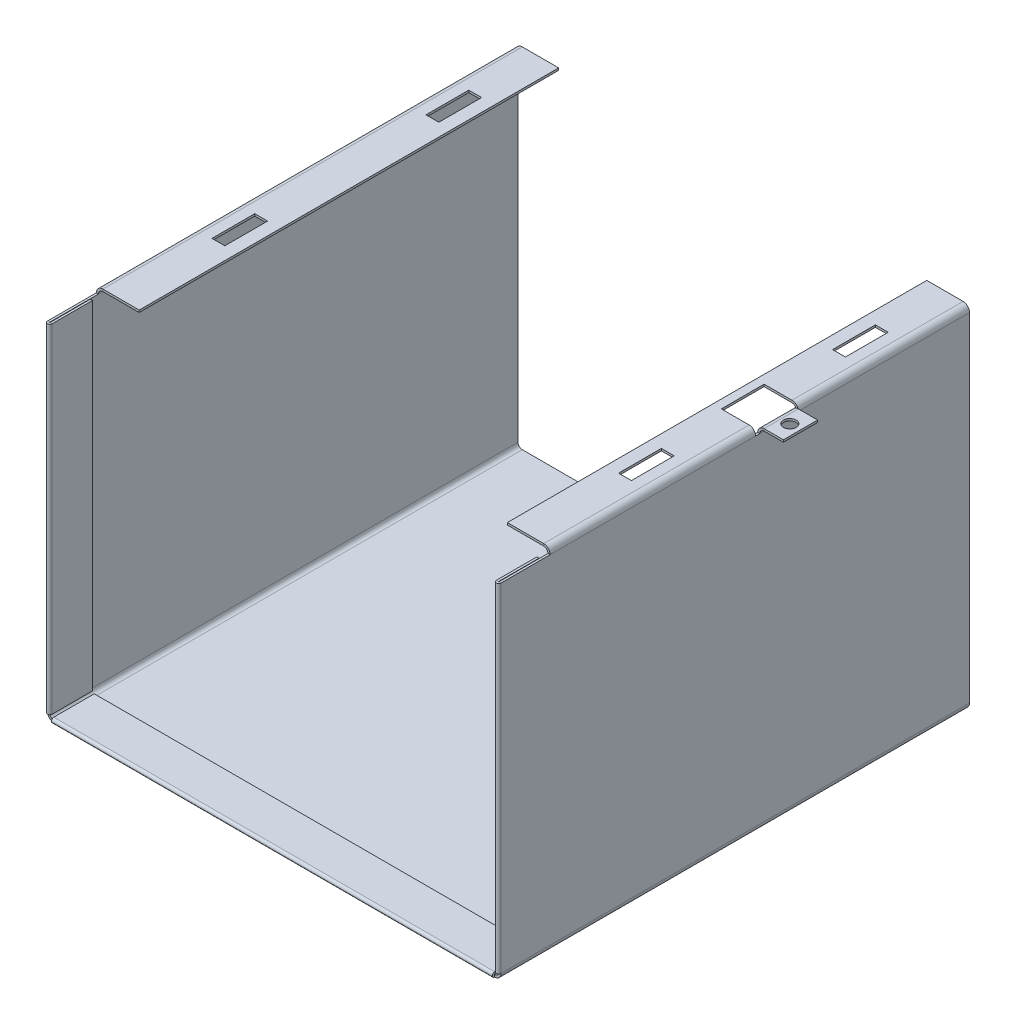
from build123d import *

# Parameters (mm, degrees)
SM_BASE_FLANGE_1_DEPTH = 55
OTHER_START            = -1
OTHER_1_DEPTH          = 2
OTHER_START_2          = 1
OTHER_1_2_DEPTH        = 79
OTHER_START_3          = -0.24719
OTHER_1_3_DEPTH        = 81.24719
OTHER_START_4          = -51.5
OTHER_1_4_DEPTH        = 103
OTHER_1_5_DEPTH        = 103
SM_EDGE_FLANGE_1_DEPTH = 98
SKETCH_19_W            = 10
SKETCH_19_H            = 10
CUT_EXTRUDE_1_DEPTH    = 1.5
SM_EDGE_FLANGE_2_DEPTH = 8
SKETCH_24_R            = 1.5
CUT_EXTRUDE_2_DEPTH    = 0.5
SKETCH_27_W            = 3
SKETCH_27_H            = 10
CUT_EXTRUDE_3_DEPTH    = 0.5


with BuildPart() as part:
    # 基体-法兰1: sheet metal written as solids
    # Sketch 1 → 基体-法兰1 (new, symmetric)
    with BuildSketch(Plane.XY):
        with BuildLine():
            Line((-52.5, 80), (-52.5, 1))
            ThreePointArc((-52.5, 1), (-52.207106781, 0.292893219), (-51.5, 0))
            Line((-51.5, 0), (51.5, 0))
            ThreePointArc((51.5, 0), (52.207106781, 0.292893219), (52.5, 1))
            Line((52.5, 1), (52.5, 80))
            Line((52.5, 80), (53, 80))
            Line((53, 80), (53, 1))
            ThreePointArc((53, 1), (52.560660172, -0.060660172), (51.5, -0.5))
            Line((51.5, -0.5), (-51.5, -0.5))
            ThreePointArc((-51.5, -0.5), (-52.560660172, -0.060660172), (-53, 1))
            Line((-53, 1), (-53, 80))
            Line((-53, 80), (-52.5, 80))
        make_face()
    extrude(amount=SM_BASE_FLANGE_1_DEPTH, both=True)

    # Other 1: read off the stored shape, not the designer's step
    # Other 1 outline → Other 1 (cut)
    with BuildSketch(Plane(origin=(0, 0, 0), x_dir=(1, 0, 0), z_dir=(0, 1, 0)).offset(OTHER_START)):
        with BuildLine():
            Line((51.5, -54.45), (51.5, -55))
            Line((51.5, -55), (52.45, -55))
            ThreePointArc((52.45, -55), (52.83890873, -54.83890873), (53, -54.45))
            Line((53, -54.45), (51.5, -54.45))
        make_face()
        with BuildLine():
            Line((-52.45, -55), (-51.5, -55))
            Line((-51.5, -55), (-51.5, -54.45))
            Line((-51.5, -54.45), (-53, -54.45))
            ThreePointArc((-53, -54.45), (-52.83890873, -54.83890873), (-52.45, -55))
        make_face()
    extrude(amount=OTHER_1_DEPTH, mode=Mode.SUBTRACT)

    # Other 1 2 outline → Other 1 2 (add)
    with BuildSketch(Plane(origin=(0, 0, 0), x_dir=(1, 0, 0), z_dir=(0, 1, 0)).offset(OTHER_START_2)):
        with BuildLine():
            Line((51.9, -45), (51.9, -54.45))
            ThreePointArc((51.9, -54.45), (52.45, -55), (53, -54.45))
            Line((53, -54.45), (52.5, -54.45))
            ThreePointArc((52.5, -54.45), (52.45, -54.5), (52.4, -54.45))
            Line((52.4, -54.45), (52.4, -45))
            Line((52.4, -45), (51.9, -45))
        make_face()
        with BuildLine():
            ThreePointArc((-53, -54.45), (-52.45, -55), (-51.9, -54.45))
            Line((-51.9, -54.45), (-51.9, -45))
            Line((-51.9, -45), (-52.4, -45))
            Line((-52.4, -45), (-52.4, -54.45))
            ThreePointArc((-52.4, -54.45), (-52.45, -54.5), (-52.5, -54.45))
            Line((-52.5, -54.45), (-53, -54.45))
        make_face()
    extrude(amount=OTHER_1_2_DEPTH)

    # Other 1 3 outline → Other 1 3 (cut)
    with BuildSketch(Plane(origin=(0, 0, 0), x_dir=(1, 0, 0), z_dir=(0, 1, 0)).offset(OTHER_START_3)):
        with BuildLine():
            ThreePointArc((-52.45, -55), (-52.83890873, -54.83890873), (-53, -54.45))
            Line((-53, -54.45), (-53, -55))
            Line((-53, -55), (-52.45, -55))
        make_face()
        with BuildLine():
            Line((52.45, -55), (53, -55))
            Line((53, -55), (53, -54.45))
            ThreePointArc((53, -54.45), (52.83890873, -54.83890873), (52.45, -55))
        make_face()
    extrude(amount=OTHER_1_3_DEPTH, mode=Mode.SUBTRACT)

    # Other 1 4 outline → Other 1 4 (cut)
    with BuildSketch(Plane.YZ.offset(OTHER_START_4)):
        with BuildLine():
            ThreePointArc((-0.5, 54.45), (-0.35620192, 54.820809924), (0, 54.997722558))
            Line((0, 54.997722558), (0, 55))
            Line((0, 55), (-0.5, 55))
            Line((-0.5, 55), (-0.5, 54.45))
        make_face()
    extrude(amount=OTHER_1_4_DEPTH, mode=Mode.SUBTRACT)

    # Other 1 5 outline → Other 1 5 (add)
    with BuildSketch(Plane.YZ.offset(OTHER_START_4)):
        with BuildLine():
            Line((0.1, 45), (0.6, 45))
            Line((0.6, 45), (0.6, 54.45))
            ThreePointArc((0.6, 54.45), (0.420809924, 54.85620192), (0, 54.997722558))
            Line((0, 54.997722558), (0, 54.45))
            ThreePointArc((0, 54.45), (0.05, 54.5), (0.1, 54.45))
            Line((0.1, 54.45), (0.1, 45))
        make_face()
    extrude(amount=OTHER_1_5_DEPTH)

    # 边线-法兰1: sheet metal written as solids
    # 边线-法兰1 section (on a plane across the edge) → 边线-法兰1 (add)
    with BuildSketch(Plane(origin=(-52.5, 81, -55), x_dir=(0, -1, 0), z_dir=(0, 0, 1))):
        with BuildLine():
            Line((-0.5, 1), (-0.5, 9.5))
            Line((-0.5, 9.5), (0, 9.5))
            Line((0, 9.5), (0, 1))
            ThreePointArc((0, 1), (0.292893219, 0.292893219), (1, 0))
            Line((1, 0), (1, -0.5))
            ThreePointArc((1, -0.5), (-0.060660172, -0.060660172), (-0.5, 1))
        make_face()
    sm_edge_flange_1 = extrude(amount=SM_EDGE_FLANGE_1_DEPTH)

    # 镜向1: 边线-法兰1 across plane
    add(sm_edge_flange_1.mirror(Plane(origin=(0, 0, 0), x_dir=(0, 0, 1), z_dir=(1, 0, 0))))

    # 草图19 → 切除-拉伸1 (cut)
    with BuildSketch(Plane(origin=(0, 81.5, 0), x_dir=(1, 0, 0), z_dir=(0, 1, 0))):
        with Locations((50, 10)):
            Rectangle(SKETCH_19_W, SKETCH_19_H)
    extrude(amount=-CUT_EXTRUDE_1_DEPTH, mode=Mode.SUBTRACT)

    # 边线-法兰2: sheet metal written as solids
    # 边线-法兰2 section (on a plane across the edge) → 边线-法兰2 (add)
    with BuildSketch(Plane(origin=(53, 81, -14), x_dir=(0, -1, 0), z_dir=(0, 0, 1))):
        with BuildLine():
            Line((-0.5, 1), (-0.5, 5.5))
            Line((-0.5, 5.5), (0, 5.5))
            Line((0, 5.5), (0, 1))
            ThreePointArc((0, 1), (0.292893219, 0.292893219), (1, 0))
            Line((1, 0), (1, -0.5))
            ThreePointArc((1, -0.5), (-0.060660172, -0.060660172), (-0.5, 1))
        make_face()
    extrude(amount=SM_EDGE_FLANGE_2_DEPTH)

    # 草图24 → 切除-拉伸2 (cut)
    with BuildSketch(Plane(origin=(0, 81.5, 0), x_dir=(1, 0, 0), z_dir=(0, 1, 0))):
        with Locations(Location((56, 10, 0), (0, 0, 180))):
            Circle(SKETCH_24_R)
    extrude(amount=-CUT_EXTRUDE_2_DEPTH, mode=Mode.SUBTRACT)

    # 草图27 → 切除-拉伸3 (cut)
    with BuildSketch(Plane(origin=(0, 81.5, 0), x_dir=(1, 0, 0), z_dir=(0, 1, 0))):
        with Locations((47.5, 35)):
            Rectangle(SKETCH_27_W, SKETCH_27_H)
        with Locations((47.5, -15)):
            Rectangle(SKETCH_27_W, SKETCH_27_H)
        with Locations((-47.5, 35)):
            Rectangle(SKETCH_27_W, SKETCH_27_H)
        with Locations((-47.5, -15)):
            Rectangle(SKETCH_27_W, SKETCH_27_H)
    extrude(amount=-CUT_EXTRUDE_3_DEPTH, mode=Mode.SUBTRACT)


solid = part.part
